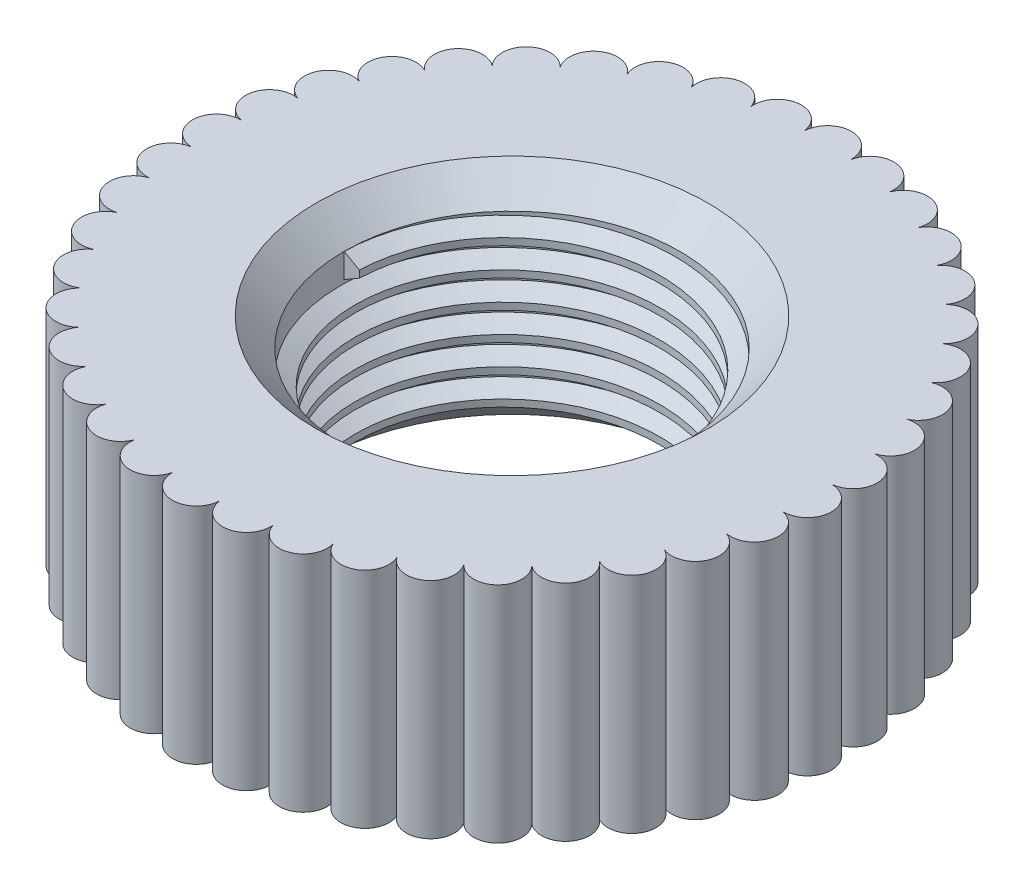
from build123d import *

# Parameters (mm, degrees)
SKETCH_1_R          = 6
SKETCH_1_R_2        = 3
EXTRUDE_1_DEPTH     = 4
CHAMFER_1_SIZE      = 0.5
THREAD_1_PITCH      = 0.5
CUT_EXTRUDE_2_DEPTH = 10


with BuildPart() as part:
    # Эскиз1 → Бобышка-Вытянуть1 (new body)
    with BuildSketch(Plane(origin=(0, 0, 0), x_dir=(1, 0, 0), z_dir=(0, 1, 0))):
        with Locations(Location((0, 0, 0), (0, 0, 270))):
            Circle(SKETCH_1_R)
        with Locations(Location((0, 0, 0), (0, 0, 270))):
            Circle(SKETCH_1_R_2, mode=Mode.SUBTRACT)
    extrude(amount=EXTRUDE_1_DEPTH)

    # Фаска1
    chamfer_1_edges = [part.edges().sort_by_distance(p)[0] for p in [
        (0, 0, -3),
        (0, 4, -3),
    ]]
    chamfer(chamfer_1_edges, length=CHAMFER_1_SIZE)

    # Резьба1: the profile of Профиль резьбы2 profile screwed along a right-hand helix of 6 turns, 6 arcs to a turn; built about Z, then put on its axis
    thread_1_z = Axis((0, 0, 0), (0, 0, 1))
    thread_1_corners = [(3.0003, 0, -0.000173205), (3.0003, 0, 0.437673204), (2.729367063, 0, 0.281249999), (2.729367063, 0, 0.156249999)]
    with BuildLine(mode=Mode.PRIVATE) as thread_1_profile:
        Line(thread_1_corners[0], thread_1_corners[1])
        Line(thread_1_corners[1], thread_1_corners[2])
        Line(thread_1_corners[2], thread_1_corners[3])
        Line(thread_1_corners[3], thread_1_corners[0])
    thread_1_cap = Face(thread_1_profile.wire())
    thread_1_turn_angles = [0, 30, 60, 90, 120, 150, 180, 210, 240, 270, 300, 330, 360]
    thread_1_turn_weights = [1, 0.8660254037844387, 1, 0.8660254037844387, 1, 0.8660254037844387, 1, 0.8660254037844387, 1, 0.8660254037844387, 1, 0.8660254037844387, 1]
    thread_1_turn_rails = [Edge.make_bspline([Vector(p[0], p[1], 0).rotate(thread_1_z, thread_1_turn_angles[k]) / thread_1_turn_weights[k] + Vector(0, 0, p[2] + THREAD_1_PITCH * thread_1_turn_angles[k] / 360) for k in range(13)], [0, 0, 0, 1, 1, 2, 2, 3, 3, 4, 4, 5, 5, 6, 6, 6], 2, thread_1_turn_weights) for p in thread_1_corners]
    thread_1_turn_sides = [Face.make_surface_from_curves(thread_1_turn_rails[p[0]], thread_1_turn_rails[p[1]]) for p in [(0, 1), (1, 2), (2, 3), (3, 0)]]
    thread_1 = Plane(origin=(0, 3.5, 0), x_dir=(-1, 0, 0), z_dir=(0, -1, 0)) * Solid(Shell([*[p.moved(Location((0, 0, THREAD_1_PITCH * i))) for i in range(6) for p in thread_1_turn_sides], thread_1_cap, thread_1_cap.rotate(thread_1_z, 2160).moved(Location((0, 0, THREAD_1_PITCH * 2160 / 360)))]))
    add(thread_1)

    # Эскиз6 → Вырез-Вытянуть-Тонкостенный2 (cut)
    with BuildSketch(Plane(origin=(0, 4, 0), x_dir=(1, 0, 0), z_dir=(0, 1, 0))):
        with BuildLine():
            ThreePointArc((-3.196498549, 15.544485909), (-1.970219746, 15.772829649), (-0.72545101, 15.853150033))
            ThreePointArc((-0.72545101, 15.853150033), (0.521451097, 15.886850215), (1.76345954, 15.77145699))
            ThreePointArc((1.76345954, 15.77145699), (3.000282083, 15.609683802), (4.208947864, 15.301418333))
            ThreePointArc((4.208947864, 15.301418333), (5.405236167, 14.948155169), (6.550797923, 14.454607975))
            ThreePointArc((6.550797923, 14.454607975), (7.677095398, 13.918553346), (8.731345596, 13.251877196))
            ThreePointArc((8.731345596, 13.251877196), (9.759919061, 12.546230546), (10.696898563, 11.72284122))
            ThreePointArc((10.696898563, 11.72284122), (11.602421125, 10.864977912), (12.399058386, 9.905149988))
            ThreePointArc((12.399058386, 9.905149988), (13.159233076, 8.916193462), (13.795912242, 7.843561089))
            ThreePointArc((13.795912242, 7.843561089), (14.392021034, 6.747862739), (14.853064952, 5.588837685))
            ThreePointArc((14.853064952, 5.588837685), (15.270429671, 4.413377239), (15.544485909, 3.196498549))
            ThreePointArc((15.544485909, 3.196498549), (15.772829649, 1.970219746), (15.853150033, 0.72545101))
            ThreePointArc((15.853150033, 0.72545101), (15.886850215, -0.521451097), (15.77145699, -1.76345954))
            ThreePointArc((15.77145699, -1.76345954), (15.609683802, -3.000282083), (15.301418333, -4.208947864))
            ThreePointArc((15.301418333, -4.208947864), (14.948155169, -5.405236167), (14.454607975, -6.550797923))
            ThreePointArc((14.454607975, -6.550797923), (13.918553346, -7.677095398), (13.251877196, -8.731345596))
            ThreePointArc((13.251877196, -8.731345596), (12.546230546, -9.759919061), (11.72284122, -10.696898563))
            ThreePointArc((11.72284122, -10.696898563), (10.864977912, -11.602421125), (9.905149988, -12.399058386))
            ThreePointArc((9.905149988, -12.399058386), (8.916193462, -13.159233076), (7.843561089, -13.795912242))
            ThreePointArc((7.843561089, -13.795912242), (6.747862739, -14.392021034), (5.588837685, -14.853064952))
            ThreePointArc((5.588837685, -14.853064952), (4.413377239, -15.270429671), (3.196498549, -15.544485909))
            ThreePointArc((3.196498549, -15.544485909), (1.970219746, -15.772829649), (0.72545101, -15.853150033))
            ThreePointArc((0.72545101, -15.853150033), (-0.521451097, -15.886850215), (-1.76345954, -15.77145699))
            ThreePointArc((-1.76345954, -15.77145699), (-3.000282083, -15.609683802), (-4.208947864, -15.301418333))
            ThreePointArc((-4.208947864, -15.301418333), (-5.405236167, -14.948155169), (-6.550797923, -14.454607975))
            ThreePointArc((-6.550797923, -14.454607975), (-7.677095398, -13.918553346), (-8.731345596, -13.251877196))
            ThreePointArc((-8.731345596, -13.251877196), (-9.759919061, -12.546230546), (-10.696898563, -11.72284122))
            ThreePointArc((-10.696898563, -11.72284122), (-11.602421125, -10.864977912), (-12.399058386, -9.905149988))
            ThreePointArc((-12.399058386, -9.905149988), (-13.159233076, -8.916193462), (-13.795912242, -7.843561089))
            ThreePointArc((-13.795912242, -7.843561089), (-14.392021034, -6.747862739), (-14.853064952, -5.588837685))
            ThreePointArc((-14.853064952, -5.588837685), (-15.270429671, -4.413377239), (-15.544485909, -3.196498549))
            ThreePointArc((-15.544485909, -3.196498549), (-15.772829649, -1.970219746), (-15.853150033, -0.72545101))
            ThreePointArc((-15.853150033, -0.72545101), (-15.886850215, 0.521451097), (-15.77145699, 1.76345954))
            ThreePointArc((-15.77145699, 1.76345954), (-15.609683802, 3.000282083), (-15.301418333, 4.208947864))
            ThreePointArc((-15.301418333, 4.208947864), (-14.948155169, 5.405236167), (-14.454607975, 6.550797923))
            ThreePointArc((-14.454607975, 6.550797923), (-13.918553346, 7.677095398), (-13.251877196, 8.731345596))
            ThreePointArc((-13.251877196, 8.731345596), (-12.546230546, 9.759919061), (-11.72284122, 10.696898563))
            ThreePointArc((-11.72284122, 10.696898563), (-10.864977912, 11.602421125), (-9.905149988, 12.399058386))
            ThreePointArc((-9.905149988, 12.399058386), (-8.916193462, 13.159233076), (-7.843561089, 13.795912242))
            ThreePointArc((-7.843561089, 13.795912242), (-6.747862739, 14.392021034), (-5.588837685, 14.853064952))
            ThreePointArc((-5.588837685, 14.853064952), (-4.413377239, 15.270429671), (-3.196498549, 15.544485909))
        make_face()
        with BuildLine():
            ThreePointArc((-1.104225781, 5.369820082), (-0.730729676, 5.84994376), (-0.250605998, 5.476447655))
            ThreePointArc((-0.250605998, 5.476447655), (0.193399641, 5.892232551), (0.609184537, 5.448226912))
            ThreePointArc((0.609184537, 5.448226912), (1.112766818, 5.789435021), (1.453974927, 5.285852741))
            ThreePointArc((1.453974927, 5.285852741), (2.004733982, 5.544082387), (2.262963629, 4.993323332))
            ThreePointArc((2.262963629, 4.993323332), (2.847337942, 5.162216045), (3.016230655, 4.577841732))
            ThreePointArc((3.016230655, 4.577841732), (3.619830993, 4.653238812), (3.695228073, 4.049638474))
            ThreePointArc((3.695228073, 4.049638474), (4.303191791, 4.029683395), (4.283236712, 3.421719678))
            ThreePointArc((4.283236712, 3.421719678), (4.880593725, 3.3069038), (4.765777848, 2.709546787))
            ThreePointArc((4.765777848, 2.709546787), (5.337819245, 2.502697258), (5.130969716, 1.930655862))
            ThreePointArc((5.130969716, 1.930655862), (5.663609939, 1.636866004), (5.369820082, 1.104225781))
            ThreePointArc((5.369820082, 1.104225781), (5.84994376, 0.730729676), (5.476447655, 0.250605998))
            ThreePointArc((5.476447655, 0.250605998), (5.892232551, -0.193399641), (5.448226912, -0.609184537))
            ThreePointArc((5.448226912, -0.609184537), (5.789435021, -1.112766818), (5.285852741, -1.453974927))
            ThreePointArc((5.285852741, -1.453974927), (5.544082387, -2.004733982), (4.993323332, -2.262963629))
            ThreePointArc((4.993323332, -2.262963629), (5.162216045, -2.847337942), (4.577841732, -3.016230655))
            ThreePointArc((4.577841732, -3.016230655), (4.653238812, -3.619830993), (4.049638474, -3.695228073))
            ThreePointArc((4.049638474, -3.695228073), (4.029683395, -4.303191791), (3.421719678, -4.283236712))
            ThreePointArc((3.421719678, -4.283236712), (3.3069038, -4.880593725), (2.709546787, -4.765777848))
            ThreePointArc((2.709546787, -4.765777848), (2.502697258, -5.337819245), (1.930655862, -5.130969716))
            ThreePointArc((1.930655862, -5.130969716), (1.636866004, -5.663609939), (1.104225781, -5.369820082))
            ThreePointArc((1.104225781, -5.369820082), (0.730729676, -5.84994376), (0.250605998, -5.476447655))
            ThreePointArc((0.250605998, -5.476447655), (-0.193399641, -5.892232551), (-0.609184537, -5.448226912))
            ThreePointArc((-0.609184537, -5.448226912), (-1.112766818, -5.789435021), (-1.453974927, -5.285852741))
            ThreePointArc((-1.453974927, -5.285852741), (-2.004733982, -5.544082387), (-2.262963629, -4.993323332))
            ThreePointArc((-2.262963629, -4.993323332), (-2.847337942, -5.162216045), (-3.016230655, -4.577841732))
            ThreePointArc((-3.016230655, -4.577841732), (-3.619830993, -4.653238812), (-3.695228073, -4.049638474))
            ThreePointArc((-3.695228073, -4.049638474), (-4.303191791, -4.029683395), (-4.283236712, -3.421719678))
            ThreePointArc((-4.283236712, -3.421719678), (-4.880593725, -3.3069038), (-4.765777848, -2.709546787))
            ThreePointArc((-4.765777848, -2.709546787), (-5.337819245, -2.502697258), (-5.130969716, -1.930655862))
            ThreePointArc((-5.130969716, -1.930655862), (-5.663609939, -1.636866004), (-5.369820082, -1.104225781))
            ThreePointArc((-5.369820082, -1.104225781), (-5.84994376, -0.730729676), (-5.476447655, -0.250605998))
            ThreePointArc((-5.476447655, -0.250605998), (-5.892232551, 0.193399641), (-5.448226912, 0.609184537))
            ThreePointArc((-5.448226912, 0.609184537), (-5.789435021, 1.112766818), (-5.285852741, 1.453974927))
            ThreePointArc((-5.285852741, 1.453974927), (-5.544082387, 2.004733982), (-4.993323332, 2.262963629))
            ThreePointArc((-4.993323332, 2.262963629), (-5.162216045, 2.847337942), (-4.577841732, 3.016230655))
            ThreePointArc((-4.577841732, 3.016230655), (-4.653238812, 3.619830993), (-4.049638474, 3.695228073))
            ThreePointArc((-4.049638474, 3.695228073), (-4.029683395, 4.303191791), (-3.421719678, 4.283236712))
            ThreePointArc((-3.421719678, 4.283236712), (-3.3069038, 4.880593725), (-2.709546787, 4.765777848))
            ThreePointArc((-2.709546787, 4.765777848), (-2.502697258, 5.337819245), (-1.930655862, 5.130969716))
            ThreePointArc((-1.930655862, 5.130969716), (-1.636866004, 5.663609939), (-1.104225781, 5.369820082))
        make_face(mode=Mode.SUBTRACT)
    extrude(amount=-CUT_EXTRUDE_2_DEPTH, mode=Mode.SUBTRACT)


solid = part.part
